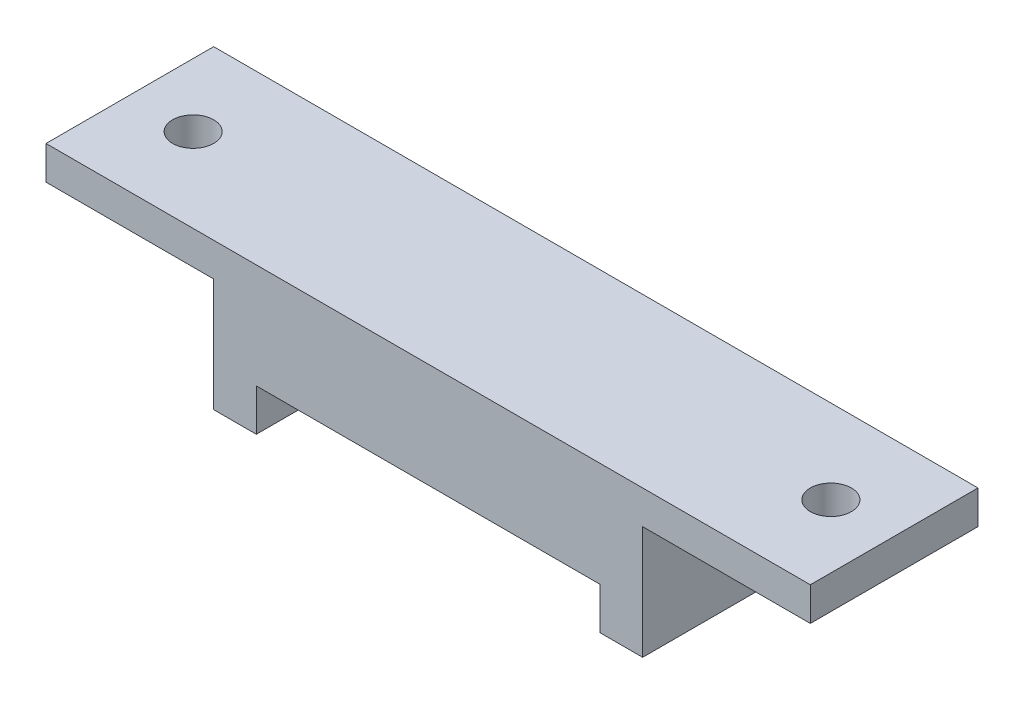
from build123d import *

# Parameters (mm, degrees)
SKETCH1_W                           = 165.58
SKETCH1_H                           = 232.3
BOSS_EXTRUDE1_DEPTH                 = 92.73
SKETCH2_W                           = 75.15
SKETCH2_H                           = 134
CUT_EXTRUDE1_DEPTH                  = 238.509525392
SKETCH3_W                           = 92.73
SKETCH3_H                           = 93.5
BOSS_EXTRUDE2_DEPTH                 = 32.57
CUT_EXTRUDE2_DEPTH                  = 79.2
CUT_EXTRUDE3_DEPTH                  = 36.3
CUT_EXTRUDE4_REACH                  = 229.171
SKETCH6_W                           = 115.5
SKETCH6_H                           = 51.5
CUT_EXTRUDE5_DEPTH                  = 115.5
SKETCH8_W                           = 115.5
SKETCH8_H                           = 10.5
CUT_EXTRUDE6_DEPTH                  = 4.5
CUT_EXTRUDE7_START                  = 13.5
SKETCH9_W                           = 115.5
SKETCH9_H                           = 58
CUT_EXTRUDE7_DEPTH                  = 4.5
CUT_EXTRUDE8_DEPTH                  = 115.5
SKETCH11_W                          = 79.15
SKETCH11_H                          = 65.15
CUT_EXTRUDE9_DEPTH                  = 90.3
SKETCH12_W                          = 16.44
SKETCH12_H                          = 88.3
CUT_EXTRUDE10_DEPTH                 = 236.602365549
SKETCH13_W                          = 58.15
SKETCH13_H                          = 58.15
CUT_EXTRUDE11_DEPTH                 = 5
F_5_0_5_DIAMETER_HOLE1_D            = 5
F_5_0_5_DIAMETER_HOLE1_DEPTH        = 5
SKETCH16_W                          = 2.45
SKETCH16_H                          = 98.3
F_4_9_4_9_DIAMETER_HOLE1_AT_2_COUNT = 2
F_4_9_4_9_DIAMETER_HOLE1_AT_2_PITCH = 66.651885195
F_4_9_4_9_DIAMETER_HOLE1_AT_3_COUNT = 2
F_4_9_4_9_DIAMETER_HOLE1_AT_3_PITCH = 47.13
F_4_9_4_9_DIAMETER_HOLE1_AT_4_COUNT = 2
F_4_9_4_9_DIAMETER_HOLE1_AT_4_PITCH = 47.13
SKETCH18_W                          = 19.55
SKETCH18_H                          = 98.3
M45_CLEARANCE_HOLE1_D               = 49.74
M45_CLEARANCE_HOLE1_DEPTH           = 2.5
FILLET1_R                           = 2.5
FILLET2_R                           = 3.758324095
SKETCH22_W                          = 123
SKETCH22_H                          = 10
BOSS_EXTRUDE3_DEPTH                 = 18
SKETCH23_W                          = 123
SKETCH23_H                          = 10
BOSS_EXTRUDE4_DEPTH                 = 17
FILLET3_R                           = 10
SKETCH26_R                          = 3.95
CUT_EXTRUDE12_DEPTH                 = 17
CUT_EXTRUDE14_DEPTH                 = 92.73
SKETCH28_W                          = 20
SKETCH28_H                          = 30
BOSS_EXTRUDE5_DEPTH                 = 20
SKETCH29_W                          = 20
SKETCH29_H                          = 30
BOSS_EXTRUDE6_DEPTH                 = 20
SKETCH30_W                          = 34
SKETCH30_H                          = 11
CUT_EXTRUDE15_DEPTH                 = 4
SKETCH31_R                          = 2.45
CUT_EXTRUDE16_DEPTH                 = 11
SKETCH32_W                          = 20
SKETCH32_H                          = 30
BOSS_EXTRUDE7_DEPTH                 = 20
SKETCH33_W                          = 20
SKETCH33_H                          = 30
BOSS_EXTRUDE8_DEPTH                 = 20
SKETCH34_R                          = 2.45
CUT_EXTRUDE17_DEPTH                 = 11
SKETCH36_W                          = 11
SKETCH36_H                          = 30
CUT_EXTRUDE19_DEPTH                 = 4
SKETCH37_W                          = 11
SKETCH37_H                          = 30
CUT_EXTRUDE20_DEPTH                 = 4
CUT_EXTRUDE18_START                 = -11
SKETCH35_R                          = 2.45
CUT_EXTRUDE18_DEPTH                 = 11
SKETCH38_W                          = 11
SKETCH38_H                          = 30
CUT_EXTRUDE21_DEPTH                 = 1.4
SKETCH39_R                          = 2.45
CUT_EXTRUDE22_DEPTH                 = 7
SKETCH40_W                          = 34
SKETCH40_H                          = 4.7
BOSS_EXTRUDE10_DEPTH                = 3.3
SKETCH41_R                          = 2.45
CUT_EXTRUDE23_DEPTH                 = 23.3
SKETCH42_W                          = 5
SKETCH42_H                          = 20.5
CUT_EXTRUDE24_DEPTH                 = 1.2
CUT_EXTRUDE25_DEPTH                 = 3
SKETCH45_W                          = 20
SKETCH45_H                          = 20
BOSS_EXTRUDE13_DEPTH                = 4.7
SKETCH46_W                          = 20
SKETCH46_H                          = 20
BOSS_EXTRUDE14_DEPTH                = 24
SKETCH47_W                          = 5
SKETCH47_H                          = 20
CUT_EXTRUDE26_DEPTH                 = 1.2
SKETCH48_R                          = 2.45
CUT_EXTRUDE27_DEPTH                 = 31.2
CUT_EXTRUDE28_DEPTH                 = 3
SKETCH50_W                          = 20
SKETCH50_H                          = 20
CUT_EXTRUDE29_DEPTH                 = 3
SKETCH52_W                          = 30
SKETCH52_H                          = 30
BOSS_EXTRUDE15_DEPTH                = 50
BOSS_EXTRUDE16_DEPTH                = 30
CUT_EXTRUDE30_DEPTH                 = 50
SKETCH55_W                          = 30
SKETCH55_H                          = 9
BOSS_EXTRUDE17_DEPTH                = 18
SKETCH56_W                          = 5
SKETCH56_H                          = 18
CUT_EXTRUDE31_DEPTH                 = 1.5
SKETCH57_R                          = 2.45
CUT_EXTRUDE32_DEPTH                 = 11.5
CUT_EXTRUDE33_DEPTH                 = 3
SKETCH59_W                          = 9
SKETCH59_H                          = 30
BOSS_EXTRUDE18_DEPTH                = 18
SKETCH62_W                          = 22.8
SKETCH62_H                          = 5
CUT_EXTRUDE35_DEPTH                 = 1.5
SKETCH63_R                          = 2.45
CUT_EXTRUDE36_DEPTH                 = 12
CUT_EXTRUDE37_DEPTH                 = 3
SKETCH67_W                          = 21
SKETCH67_H                          = 5
CUT_EXTRUDE40_DEPTH                 = 45
SKETCH69_R                          = 5
CUT_EXTRUDE42_DEPTH                 = 30
SKETCH71_W                          = 4.5
SKETCH71_H                          = 4
CUT_EXTRUDE43_DEPTH                 = 115.5
BOSS_EXTRUDE19_DEPTH                = 115.5
SKETCH73_W                          = 32
SKETCH73_H                          = 0.465
CUT_EXTRUDE44_DEPTH                 = 115.5
BOSS_EXTRUDE21_START                = -5
SKETCH74_R                          = 2.5
BOSS_EXTRUDE21_DEPTH                = 5
SKETCH75_R                          = 2.45
CUT_EXTRUDE45_DEPTH                 = 5
SKETCH79_W                          = 65.082601473
SKETCH79_H                          = 90.740818932
CUT_EXTRUDE46_DEPTH                 = 20
SKETCH80_W                          = 34
SKETCH80_H                          = 11
BOSS_EXTRUDE22_DEPTH                = 11
SKETCH81_W                          = 63.959797262
SKETCH81_H                          = 80.4
CUT_EXTRUDE47_DEPTH                 = 20
SKETCH82_W                          = 40
SKETCH82_H                          = 20
CUT_EXTRUDE48_DEPTH                 = 21
SKETCH83_W                          = 40
SKETCH83_H                          = 20
CUT_EXTRUDE49_DEPTH                 = 21
SKETCH84_W                          = 21.566024368
SKETCH84_H                          = 21.353891393
BOSS_EXTRUDE23_DEPTH                = 92.73
SKETCH85_W                          = 90.43
SKETCH85_H                          = 30.5
CUT_EXTRUDE50_DEPTH                 = 9
SKETCH86_W                          = 90.43
SKETCH86_H                          = 30.5
CUT_EXTRUDE51_DEPTH                 = 9
SKETCH87_W                          = 34.73
SKETCH87_H                          = 30.5
CUT_EXTRUDE52_DEPTH                 = 90.43
SKETCH88_W                          = 18
SKETCH88_H                          = 12.59228479
SKETCH88_H_2                        = 17.40771521
SKETCH88_W_2                        = 5
SKETCH88_H_3                        = 18
SKETCH88_W_3                        = 12.5
CUT_EXTRUDE53_DEPTH                 = 9
BOSS_EXTRUDE24_DEPTH                = 30
SKETCH90_W                          = 4.8
SKETCH90_H                          = 5
BOSS_EXTRUDE25_DEPTH                = 1.5
SKETCH91_W                          = 5.95
SKETCH91_H                          = 20.4
BOSS_EXTRUDE26_DEPTH                = 50
BOSS_EXTRUDE27_REACH                = 298.893
SKETCH94_W                          = 18.5
SKETCH94_H                          = 5.65771521
SKETCH94_H_2                        = 30
SKETCH94_W_2                        = 8.5
SKETCH94_H_3                        = 20.4
SKETCH94_H_4                        = 5.84228479
CUT_EXTRUDE54_START                 = -50
CUT_EXTRUDE54_OUTLINE_W             = 5.75
CUT_EXTRUDE54_OUTLINE_H             = 33.96543042
CUT_EXTRUDE54_OUTLINE_H_2           = 30
CUT_EXTRUDE54_DEPTH                 = 50
SKETCH96_W                          = 6.443449297
SKETCH96_H                          = 0.829453856
SKETCH96_W_2                        = 5.985
SKETCH96_H_2                        = 0.414726928
CUT_EXTRUDE55_DEPTH                 = 50
SKETCH98_W                          = 90.43
SKETCH98_H                          = 30.5
BOSS_EXTRUDE28_DEPTH                = 13
SKETCH99_W                          = 90.43
SKETCH99_H                          = 10
BOSS_EXTRUDE29_DEPTH                = 13
SKETCH100_W                         = 32.57
SKETCH100_H                         = 10
BOSS_EXTRUDE30_DEPTH                = 13
SKETCH102_W                         = 50.73
SKETCH102_H                         = 30.5
CUT_EXTRUDE56_DEPTH                 = 99
SKETCH103_W                         = 8.4
SKETCH103_H                         = 30.4
CUT_EXTRUDE57_DEPTH                 = 50
SKETCH104_W                         = 0.05
SKETCH104_H                         = 20.4
BOSS_EXTRUDE31_DEPTH                = 50
SKETCH105_W                         = 9
SKETCH105_H                         = 0.05
BOSS_EXTRUDE32_DEPTH                = 90.43
SKETCH106_W                         = 9
SKETCH106_H                         = 0.05
BOSS_EXTRUDE33_DEPTH                = 32.57
SKETCH109_W                         = 18.5
SKETCH109_H                         = 41.5
SKETCH109_W_2                       = 8.4
SKETCH109_H_2                       = 30.4
BOSS_EXTRUDE34_DEPTH                = 20
SKETCH110_W                         = 50.73
SKETCH110_H                         = 30.5
BOSS_EXTRUDE35_DEPTH                = 5
SKETCH113_W                         = 172.054725646
SKETCH113_H                         = 266.387097994
CUT_EXTRUDE58_DEPTH                 = 138.8
SKETCH114_W                         = 178.406474635
SKETCH114_H                         = 123.917797654
CUT_EXTRUDE59_DEPTH                 = 18
SKETCH115_W                         = 177.074465968
SKETCH115_H                         = 136.072490388
CUT_EXTRUDE60_DEPTH                 = 17
SKETCH116_W                         = 133.782615836
SKETCH116_H                         = 155.721244156
CUT_EXTRUDE61_DEPTH                 = 108
SKETCH117_W                         = 5.565
SKETCH117_H                         = 88.035
SKETCH117_W_2                       = 15.9965
CUT_EXTRUDE62_DEPTH                 = 20
SKETCH118_W                         = 71.1685
SKETCH118_H                         = 5
CUT_EXTRUDE63_DEPTH                 = 20
BOSS_EXTRUDE36_START                = 5
SKETCH119_R                         = 2.45
BOSS_EXTRUDE36_DEPTH                = 5
SKETCH120_W                         = 20
SKETCH120_H                         = 5
BOSS_EXTRUDE37_DEPTH                = 14.432517826
SKETCH121_W                         = 71.1685
SKETCH121_H                         = 20
BOSS_EXTRUDE38_DEPTH                = 7.5
SKETCH126_W                         = 20
SKETCH126_H                         = 14
CUT_EXTRUDE65_DEPTH                 = 10
SKETCH123_W                         = 20
SKETCH123_H                         = 5
BOSS_EXTRUDE41_DEPTH                = 10
SKETCH128_R                         = 2.45
CUT_EXTRUDE66_DEPTH                 = 10
SKETCH124_W                         = 20
SKETCH124_H                         = 5
BOSS_EXTRUDE42_DEPTH                = 10
SKETCH129_R                         = 2.45
CUT_EXTRUDE67_DEPTH                 = 10
SKETCH130_W                         = 71.1685
SKETCH130_H                         = 71.535
CUT_EXTRUDE68_DEPTH                 = 20
CUT_EXTRUDE69_DEPTH                 = 20
SKETCH132_W                         = 5.344
SKETCH132_H                         = 20
SKETCH132_W_2                       = 5.441
CUT_EXTRUDE70_DEPTH                 = 1.5
SKETCH133_W                         = 40.995
SKETCH133_H                         = 5
CUT_EXTRUDE71_DEPTH                 = 20
SKETCH134_W                         = 0.05
SKETCH134_H                         = 5
CUT_EXTRUDE72_DEPTH                 = 20
SKETCH135_W                         = 0.05
SKETCH135_H                         = 5
BOSS_EXTRUDE43_DEPTH                = 20
SKETCH138_W                         = 19.9985
SKETCH138_H                         = 20
SKETCH138_W_2                       = 20
CUT_EXTRUDE73_DEPTH                 = 1


# Read off the part's stored shape, not the designer's step: Cut-Extrude54
with BuildPart() as part:
    # Sketch1 → Boss-Extrude1 (new body)
    with BuildSketch(Plane(origin=(45.486013603, 0, 0), x_dir=(0, 0, -1), z_dir=(1, 0, 0))):
        with Locations((-19.180804236, 77.276670435)):
            Rectangle(SKETCH1_W, SKETCH1_H)
    extrude(amount=-BOSS_EXTRUDE1_DEPTH)

    # Sketch2 → Cut-Extrude1 (cut, through all)
    with BuildSketch(Plane.ZY.offset(47.243986397)):
        with Locations((64.395804236, 28.126670435)):
            Rectangle(SKETCH2_W, SKETCH2_H)
    extrude(amount=-CUT_EXTRUDE1_DEPTH, mode=Mode.SUBTRACT)

    # Sketch3 → Boss-Extrude2 (add)
    with BuildSketch(Plane.XY.offset(26.820804236)):
        with Locations((-0.878986397, 7.876670435)):
            Rectangle(SKETCH3_W, SKETCH3_H)
    extrude(amount=BOSS_EXTRUDE2_DEPTH)

    # Sketch4 → Cut-Extrude2 (cut)
    with BuildSketch(Plane.XY.offset(59.390804236)):
        with BuildLine():
            Line((1.078889782, -38.873329565), (1.078889782, -28.873329565))
            ThreePointArc((1.078889782, -28.873329565), (1.700753014, -28.742266644), (2.047801243, -28.209867454))
            Line((2.047801243, -28.209867454), (5.383137423, -22.873329565))
            Line((5.383137423, -22.873329565), (9.856013603, -22.873329565))
            Line((9.856013603, -22.873329565), (9.856013603, 44.626670435))
            Line((9.856013603, 44.626670435), (-22.143986397, 44.626670435))
            Line((-22.143986397, 44.626670435), (-22.143986397, -22.873329565))
            Line((-22.143986397, -22.873329565), (-17.671110218, -22.873329565))
            Line((-17.671110218, -22.873329565), (-14.305353901, -28.258539673))
            ThreePointArc((-14.305353901, -28.258539673), (-13.956818128, -28.763043498), (-13.353628044, -28.873329565))
            Line((-13.353628044, -28.873329565), (-13.353628044, -38.873329565))
            Line((-13.353628044, -38.873329565), (1.078889782, -38.873329565))
        make_face()
    extrude(amount=-CUT_EXTRUDE2_DEPTH, mode=Mode.SUBTRACT)

    # Sketch5 → Cut-Extrude3 (cut)
    with BuildSketch(Plane.XY.offset(-19.809195764)):
        with BuildLine():
            Line((9.856013603, -22.873329565), (9.856013603, 44.626670435))
            Line((9.856013603, 44.626670435), (-22.143986397, 44.626670435))
            Line((-22.143986397, 44.626670435), (-22.143986397, -22.873329565))
            Line((-22.143986397, -22.873329565), (-17.671110218, -22.873329565))
            Line((-17.671110218, -22.873329565), (-14.305353901, -28.258539673))
            ThreePointArc((-14.305353901, -28.258539673), (-13.956818128, -28.763043498), (-13.353628044, -28.873329565))
            Line((-13.353628044, -28.873329565), (1.078889782, -28.873329565))
            ThreePointArc((1.078889782, -28.873329565), (1.700753014, -28.742266644), (2.047801243, -28.209867454))
            Line((2.047801243, -28.209867454), (5.383137423, -22.873329565))
            Line((5.383137423, -22.873329565), (9.856013603, -22.873329565))
        make_face()
    extrude(amount=-CUT_EXTRUDE3_DEPTH, mode=Mode.SUBTRACT)

    # Sketch6 → Cut-Extrude4 (cut, up to next)
    with BuildSketch(Plane(origin=(14.356013603, 0, 0), x_dir=(0, 0, -1), z_dir=(1, 0, 0)), mode=Mode.PRIVATE) as cut_extrude4_sk1:
        with Locations((-1.640804236, 18.876670435)):
            Rectangle(SKETCH6_W, SKETCH6_H)
    cut_extrude4_tool1 = extrude(cut_extrude4_sk1.sketch, amount=-CUT_EXTRUDE4_REACH, mode=Mode.PRIVATE) & part.part
    add(cut_extrude4_tool1.solids().sort_by_distance((14.356014, 18.87667, 1.640804))[0], mode=Mode.SUBTRACT)

    # Sketch7 → Cut-Extrude5 (cut)
    with BuildSketch(Plane.XY.offset(59.390804236)):
        with BuildLine():
            Line((14.356013603, 36.626670435), (14.356013603, -6.873329565))
            Line((14.356013603, -6.873329565), (20.856013603, -6.873329565))
            ThreePointArc((20.856013603, -6.873329565), (23.527333946, -6.222467368), (24.956013603, -3.873329565))
            Line((24.956013603, -3.873329565), (24.956013603, 34.126670435))
            Line((24.956013603, 34.126670435), (18.356013603, 34.126670435))
            ThreePointArc((18.356013603, 34.126670435), (15.83824665, 34.54824331), (14.356013603, 36.626670435))
        make_face()
    extrude(amount=-CUT_EXTRUDE5_DEPTH, mode=Mode.SUBTRACT)

    # Sketch8 → Cut-Extrude6 (cut)
    with BuildSketch(Plane.ZY.offset(-9.856013603)):
        with Locations((1.640804236, -12.123329565)):
            Rectangle(SKETCH8_W, SKETCH8_H)
    extrude(amount=-CUT_EXTRUDE6_DEPTH, mode=Mode.SUBTRACT)

    # Sketch9 → Cut-Extrude7 (cut)
    with BuildSketch(Plane(origin=(-35.643986397, 0, 0), x_dir=(0, 0, -1), z_dir=(1, 0, 0)).offset(CUT_EXTRUDE7_START)):
        with Locations((-1.640804236, 15.626670435)):
            Rectangle(SKETCH9_W, SKETCH9_H)
    extrude(amount=-CUT_EXTRUDE7_DEPTH, mode=Mode.SUBTRACT)

    # Sketch10 → Cut-Extrude8 (cut)
    with BuildSketch(Plane.XY.offset(59.390804236)):
        with BuildLine():
            Line((-26.643986397, -9.373329565), (-26.643986397, 34.126670435))
            Line((-26.643986397, 34.126670435), (-37.143986397, 34.126670435))
            Line((-37.143986397, 34.126670435), (-37.143986397, -6.873329565))
            Line((-37.143986397, -6.873329565), (-30.643986397, -6.873329565))
            ThreePointArc((-30.643986397, -6.873329565), (-28.126219444, -7.294902441), (-26.643986397, -9.373329565))
        make_face()
    extrude(amount=-CUT_EXTRUDE8_DEPTH, mode=Mode.SUBTRACT)

    # Sketch11 → Cut-Extrude9 (cut)
    with BuildSketch(Plane(origin=(0, 193.426670435, 0), x_dir=(-1, 0, 0), z_dir=(0, 1, 0))):
        with Locations((-0.911013603, 64.395804236)):
            Rectangle(SKETCH11_W, SKETCH11_H)
    extrude(amount=-CUT_EXTRUDE9_DEPTH, mode=Mode.SUBTRACT)

    # Sketch12 → Cut-Extrude10 (cut, through all)
    with BuildSketch(Plane.ZY.offset(-40.486013603)):
        with Locations((63.849186595, 149.276670435)):
            Rectangle(SKETCH12_W, SKETCH12_H)
    extrude(amount=-CUT_EXTRUDE10_DEPTH, mode=Mode.SUBTRACT)

    # Sketch13 → Cut-Extrude11 (cut)
    with BuildSketch(Plane(origin=(0, 103.126670435, 0), x_dir=(-1, 0, 0), z_dir=(0, 1, 0))):
        with Locations((6.088986397, 64.395804236)):
            Rectangle(SKETCH13_W, SKETCH13_H)
    extrude(amount=-CUT_EXTRUDE11_DEPTH, mode=Mode.SUBTRACT)

    # Ø5.0 (5) Diameter Hole1
    with Locations(Plane.XY.offset(59.390804236)):
        with Locations((18.856013603, -11.373329565), (-31.143986397, 38.626670435), (18.856013603, 38.626670435), (-31.143986397, -11.373329565)):
            Hole(F_5_0_5_DIAMETER_HOLE1_D / 2, depth=F_5_0_5_DIAMETER_HOLE1_DEPTH)

    # Sketch16 → Ø4.9 (4.9) Diameter Hole1 (revolve, cut)
    with BuildSketch(Plane(origin=(-29.653986397, 95.126670435, 87.960804236), x_dir=(0, 0, -1), z_dir=(1, 0, 0))):
        with Locations((1.225, 49.15)):
            Rectangle(SKETCH16_W, SKETCH16_H)
    f_4_9_4_9_diameter_hole1 = revolve(axis=Axis((-29.653986397, 88.776670435, 87.960804236), (0, 1, 0)), mode=Mode.SUBTRACT)

    # Ø4.9 (4.9) Diameter Hole1 at 2: Ø4.9 (4.9) Diameter Hole1 ×2
    with Locations(*[Vector(0.7071067811865476, 0, -0.7071067811865476) * (i * F_4_9_4_9_DIAMETER_HOLE1_AT_2_PITCH) for i in range(1, F_4_9_4_9_DIAMETER_HOLE1_AT_2_COUNT)]):
        add(f_4_9_4_9_diameter_hole1, mode=Mode.SUBTRACT)

    # Ø4.9 (4.9) Diameter Hole1 at 3: Ø4.9 (4.9) Diameter Hole1 ×2
    with Locations(*[(i * F_4_9_4_9_DIAMETER_HOLE1_AT_3_PITCH, 0, 0) for i in range(1, F_4_9_4_9_DIAMETER_HOLE1_AT_3_COUNT)]):
        add(f_4_9_4_9_diameter_hole1, mode=Mode.SUBTRACT)

    # Ø4.9 (4.9) Diameter Hole1 at 4: Ø4.9 (4.9) Diameter Hole1 ×2
    with Locations(*[(0, 0, -i * F_4_9_4_9_DIAMETER_HOLE1_AT_4_PITCH) for i in range(1, F_4_9_4_9_DIAMETER_HOLE1_AT_4_COUNT)]):
        add(f_4_9_4_9_diameter_hole1, mode=Mode.SUBTRACT)

    # Sketch18 → M36 Clearance Hole1 (revolve, cut)
    with BuildSketch(Plane(origin=(-6.088986397, 95.126670435, 64.395804236), x_dir=(0, 0, -1), z_dir=(1, 0, 0))):
        with Locations((9.775, 49.15)):
            Rectangle(SKETCH18_W, SKETCH18_H)
    revolve(axis=Axis((-6.088986397, 88.776670435, 64.395804236), (0, 1, 0)), mode=Mode.SUBTRACT)

    # M45 Clearance Hole1
    with Locations(Plane.XY.offset(-56.109195764)):
        with Locations((-6.143986397, 13.626670435)):
            Hole(M45_CLEARANCE_HOLE1_D / 2, depth=M45_CLEARANCE_HOLE1_DEPTH)

    # Fillet1
    fillet1_edges = [part.edges().sort_by_distance(p)[0] for p in [
        (14.356013603, -6.873329565, 1.640804236),
        (-26.643986397, 34.126670435, 1.640804236),
        (22.986013603, 100.626670435, 35.320804236),
        (22.986013603, 100.626670435, 93.470804236),
        (-35.163986397, 100.626670435, 93.470804236),
        (-35.163986397, 100.626670435, 35.320804236),
    ]]
    fillet(fillet1_edges, radius=FILLET1_R)

    # Fillet2
    fillet2_edges = [part.edges().sort_by_distance(p)[0] for p in [
        (14.356013603, 44.626670435, 1.640804236),
        (-37.143986397, 34.126670435, 1.640804236),
    ]]
    fillet(fillet2_edges, radius=FILLET2_R)

    # Sketch22 → Boss-Extrude3 (add)
    with BuildSketch(Plane.ZY.offset(47.243986397)):
        with Locations((-2.109195764, -33.873329565)):
            Rectangle(SKETCH22_W, SKETCH22_H)
    extrude(amount=BOSS_EXTRUDE3_DEPTH)

    # Sketch23 → Boss-Extrude4 (add)
    with BuildSketch(Plane(origin=(45.486013603, 0, 0), x_dir=(0, 0, -1), z_dir=(1, 0, 0))):
        with Locations((2.109195764, -33.873329565)):
            Rectangle(SKETCH23_W, SKETCH23_H)
    extrude(amount=BOSS_EXTRUDE4_DEPTH)

    # Fillet3
    fillet3_edges = [part.edges().sort_by_distance(p)[0] for p in [
        (62.486013603, -33.873329565, -63.609195764),
    ]]
    fillet(fillet3_edges, radius=FILLET3_R)

    # Sketch26 → Cut-Extrude12 (cut)
    with BuildSketch(Plane.XZ.offset(38.873329565)):
        with Locations(Location((53.036013603, -54.159195764, 0), (0, 0, 270))):
            Circle(SKETCH26_R)
        with Locations(Location((-56.243986397, -2.109195764, 0), (0, 0, 270))):
            Circle(SKETCH26_R)
        with Locations(Location((-56.243986397, 51.940804236, 0), (0, 0, 270))):
            Circle(SKETCH26_R)
        with Locations(Location((53.986013603, 51.940804236, 0), (0, 0, 270))):
            Circle(SKETCH26_R)
        with Locations(Location((53.986013603, -2.109195764, 0), (0, 0, 270))):
            Circle(SKETCH26_R)
        with Locations(Location((-57.793986397, -56.159195764, 0), (0, 0, 270))):
            Circle(SKETCH26_R)
    extrude(amount=-CUT_EXTRUDE12_DEPTH, mode=Mode.SUBTRACT)

    # Sketch27 → Cut-Extrude14 (cut)
    with BuildSketch(Plane.ZY.offset(47.243986397)):
        with BuildLine():
            Line((-53.609195764, 55.136670435), (-53.609195764, 74.516670435))
            ThreePointArc((-53.609195764, 74.516670435), (-53.459820222, 74.877294893), (-53.099195764, 75.026670435))
            Line((-53.099195764, 75.026670435), (-33.719195764, 75.026670435))
            ThreePointArc((-33.719195764, 75.026670435), (-33.358571305, 74.877294893), (-33.209195764, 74.516670435))
            Line((-33.209195764, 74.516670435), (-33.209195764, 55.136670435))
            ThreePointArc((-33.209195764, 55.136670435), (-33.358571305, 54.776045976), (-33.719195764, 54.626670435))
            Line((-33.719195764, 54.626670435), (-53.099195764, 54.626670435))
            ThreePointArc((-53.099195764, 54.626670435), (-53.459820222, 54.776045976), (-53.609195764, 55.136670435))
        make_face()
    extrude(amount=-CUT_EXTRUDE14_DEPTH, mode=Mode.SUBTRACT)

    # Sketch28 → Boss-Extrude5 (add)
    with BuildSketch(Plane.ZY.offset(47.243986397)):
        with Locations((-43.409195764, 39.626670435)):
            Rectangle(SKETCH28_W, SKETCH28_H)
    extrude(amount=BOSS_EXTRUDE5_DEPTH)

    # Sketch29 → Boss-Extrude6 (add)
    with BuildSketch(Plane(origin=(45.486013603, 0, 0), x_dir=(0, 0, -1), z_dir=(1, 0, 0))):
        with Locations((43.409195764, 39.626670435)):
            Rectangle(SKETCH29_W, SKETCH29_H)
    extrude(amount=BOSS_EXTRUDE6_DEPTH)

    # Sketch30 → Cut-Extrude15 (cut)
    with BuildSketch(Plane.ZY.offset(47.243986397)):
        with Locations((-16.209195764, 64.826670435)):
            Rectangle(SKETCH30_W, SKETCH30_H)
    extrude(amount=-CUT_EXTRUDE15_DEPTH, mode=Mode.SUBTRACT)

    # Sketch31 → Cut-Extrude16 (cut)
    with BuildSketch(Plane.ZY.offset(47.243986397)):
        with Locations((-28.249195764, 64.826670435)):
            Circle(SKETCH31_R)
        with Locations((-8.249195764, 64.826670435)):
            Circle(SKETCH31_R)
    extrude(amount=-CUT_EXTRUDE16_DEPTH, mode=Mode.SUBTRACT)

    # Sketch32 → Boss-Extrude7 (add)
    with BuildSketch(Plane.ZY.offset(47.243986397)):
        with Locations((-43.409195764, 90.026670435)):
            Rectangle(SKETCH32_W, SKETCH32_H)
    extrude(amount=BOSS_EXTRUDE7_DEPTH)

    # Sketch33 → Boss-Extrude8 (add)
    with BuildSketch(Plane(origin=(45.486013603, 0, 0), x_dir=(0, 0, -1), z_dir=(1, 0, 0))):
        with Locations((43.409195764, 90.026670435)):
            Rectangle(SKETCH33_W, SKETCH33_H)
    extrude(amount=BOSS_EXTRUDE8_DEPTH)

    # Sketch34 → Cut-Extrude17 (cut)
    with BuildSketch(Plane.ZY.offset(67.243986397)):
        with Locations((-43.409195764, 79.986670435)):
            Circle(SKETCH34_R)
        with Locations((-43.409195764, 99.986670435)):
            Circle(SKETCH34_R)
    extrude(amount=-CUT_EXTRUDE17_DEPTH, mode=Mode.SUBTRACT)

    # Sketch36 → Cut-Extrude19 (cut)
    with BuildSketch(Plane.ZY.offset(67.243986397)):
        with Locations((-43.409195764, 90.026670435)):
            Rectangle(SKETCH36_W, SKETCH36_H)
    extrude(amount=-CUT_EXTRUDE19_DEPTH, mode=Mode.SUBTRACT)

    # Sketch37 → Cut-Extrude20 (cut)
    with BuildSketch(Plane(origin=(65.486013603, 0, 0), x_dir=(0, 0, -1), z_dir=(1, 0, 0))):
        with Locations((43.409195764, 90.026670435)):
            Rectangle(SKETCH37_W, SKETCH37_H)
    extrude(amount=-CUT_EXTRUDE20_DEPTH, mode=Mode.SUBTRACT)

    # Sketch35 → Cut-Extrude18 (cut)
    with BuildSketch(Plane(origin=(65.486013603, 0, 0), x_dir=(0, 0, -1), z_dir=(1, 0, 0)).offset(CUT_EXTRUDE18_START)):
        with Locations(Location((43.409195764, 79.986670435, 0), (0, 0, 180))):
            Circle(SKETCH35_R)
        with Locations(Location((43.409195764, 99.986670435, 0), (0, 0, 180))):
            Circle(SKETCH35_R)
    extrude(amount=CUT_EXTRUDE18_DEPTH, mode=Mode.SUBTRACT)

    # Sketch38 → Cut-Extrude21 (cut)
    with BuildSketch(Plane.ZY.offset(67.243986397)):
        with Locations((-43.409195764, 39.626670435)):
            Rectangle(SKETCH38_W, SKETCH38_H)
    cut_extrude21 = extrude(amount=-CUT_EXTRUDE21_DEPTH, mode=Mode.SUBTRACT)

    # Sketch39 → Cut-Extrude22 (cut)
    with BuildSketch(Plane.ZY.offset(65.843986397)):
        with Locations((-43.409195764, 49.866670435)):
            Circle(SKETCH39_R)
        with Locations((-43.409195764, 29.866670435)):
            Circle(SKETCH39_R)
    cut_extrude22 = extrude(amount=-CUT_EXTRUDE22_DEPTH, mode=Mode.SUBTRACT)

    # Sketch40 → Boss-Extrude10 (add)
    with BuildSketch(Plane.ZY.offset(47.243986397)):
        with Locations((-16.209195764, 72.676670435)):
            Rectangle(SKETCH40_W, SKETCH40_H)
        with Locations((-16.209195764, 56.976670435)):
            Rectangle(SKETCH40_W, SKETCH40_H)
    boss_extrude10 = extrude(amount=BOSS_EXTRUDE10_DEPTH)

    # Sketch41 → Cut-Extrude23 (cut)
    with BuildSketch(Plane.XY.offset(-33.409195764)):
        with Locations((-60.643986397, 86.276670435)):
            Circle(SKETCH41_R)
    cut_extrude23 = extrude(amount=-CUT_EXTRUDE23_DEPTH, mode=Mode.SUBTRACT)

    # Sketch42 → Cut-Extrude24 (cut)
    with BuildSketch(Plane.XY.offset(-33.409195764)):
        with Locations((-60.643986397, 85.276670435)):
            Rectangle(SKETCH42_W, SKETCH42_H)
    cut_extrude24 = extrude(amount=-CUT_EXTRUDE24_DEPTH, mode=Mode.SUBTRACT)

    # Sketch43 → Cut-Extrude25 (cut)
    with BuildSketch(Plane(origin=(0, 0, -53.409195764), x_dir=(-1, 0, 0), z_dir=(0, 0, -1))):
        Polygon((65.551463685, 86.276670435), (63.097725041, 90.526670435), (58.190247753, 90.526670435), (55.736509109, 86.276670435), (58.190247753, 82.026670435), (63.097725041, 82.026670435), align=None)
    cut_extrude25 = extrude(amount=-CUT_EXTRUDE25_DEPTH, mode=Mode.SUBTRACT)

    # Sketch45 → Boss-Extrude13 (add)
    with BuildSketch(Plane.ZY.offset(47.243986397)):
        with Locations((49.390804236, 44.626670435)):
            Rectangle(SKETCH45_W, SKETCH45_H)
    boss_extrude13 = extrude(amount=BOSS_EXTRUDE13_DEPTH)

    # Sketch46 → Boss-Extrude14 (add)
    with BuildSketch(Plane.ZY.offset(47.243986397)):
        with Locations((29.390804236, 44.626670435)):
            Rectangle(SKETCH46_W, SKETCH46_H)
    boss_extrude14 = extrude(amount=BOSS_EXTRUDE14_DEPTH)

    # Sketch47 → Cut-Extrude26 (cut)
    with BuildSketch(Plane.XY.offset(39.390804236)):
        with Locations((-60.643986397, 44.626670435)):
            Rectangle(SKETCH47_W, SKETCH47_H)
    cut_extrude26 = extrude(amount=-CUT_EXTRUDE26_DEPTH, mode=Mode.SUBTRACT)

    # Sketch48 → Cut-Extrude27 (cut)
    with BuildSketch(Plane.XY.offset(38.190804236)):
        with Locations((-60.643986397, 43.926670435)):
            Circle(SKETCH48_R)
    cut_extrude27 = extrude(amount=-CUT_EXTRUDE27_DEPTH, mode=Mode.SUBTRACT)

    # Sketch49 → Cut-Extrude28 (cut)
    with BuildSketch(Plane(origin=(0, 0, 19.390804236), x_dir=(-1, 0, 0), z_dir=(0, 0, -1))):
        Polygon((64.893986397, 41.472931791), (64.893986397, 46.380409079), (60.643986397, 48.834147723), (56.393986397, 46.380409079), (56.393986397, 41.472931791), (60.643986397, 39.019193147), align=None)
    cut_extrude28 = extrude(amount=-CUT_EXTRUDE28_DEPTH, mode=Mode.SUBTRACT)

    # Sketch50 → Cut-Extrude29 (cut)
    with BuildSketch(Plane.ZY.offset(71.243986397)):
        with Locations((29.390804236, 44.626670435)):
            Rectangle(SKETCH50_W, SKETCH50_H)
    cut_extrude29 = extrude(amount=-CUT_EXTRUDE29_DEPTH, mode=Mode.SUBTRACT)

    # Mirror1: Boss-Extrude10 across plane
    add(boss_extrude10.mirror(Plane.ZY.offset(0.878986397)))

    # Mirror2: Cut-Extrude21, Cut-Extrude22 across plane
    add(cut_extrude21.mirror(Plane.ZY.offset(0.878986397)), mode=Mode.SUBTRACT)
    add(cut_extrude22.mirror(Plane.ZY.offset(0.878986397)), mode=Mode.SUBTRACT)

    # Mirror3: Cut-Extrude23, Cut-Extrude24, Cut-Extrude25 across plane
    add(cut_extrude23.mirror(Plane.ZY.offset(0.878986397)), mode=Mode.SUBTRACT)
    add(cut_extrude24.mirror(Plane.ZY.offset(0.878986397)), mode=Mode.SUBTRACT)
    add(cut_extrude25.mirror(Plane.ZY.offset(0.878986397)), mode=Mode.SUBTRACT)

    # Mirror4: Boss-Extrude13, Boss-Extrude14, Cut-Extrude29 across plane
    add(boss_extrude13.mirror(Plane.ZY.offset(0.878986397)))
    add(boss_extrude14.mirror(Plane.ZY.offset(0.878986397)))
    add(cut_extrude29.mirror(Plane.ZY.offset(0.878986397)), mode=Mode.SUBTRACT)

    # Mirror5: Cut-Extrude26, Cut-Extrude27, Cut-Extrude28 across plane
    add(cut_extrude26.mirror(Plane.ZY.offset(0.878986397)), mode=Mode.SUBTRACT)
    add(cut_extrude27.mirror(Plane.ZY.offset(0.878986397)), mode=Mode.SUBTRACT)
    add(cut_extrude28.mirror(Plane.ZY.offset(0.878986397)), mode=Mode.SUBTRACT)

    # Sketch52 → Boss-Extrude15 (add)
    with BuildSketch(Plane.XY.offset(101.970804236)):
        with Locations((-0.878986397, 144.276670435)):
            Rectangle(SKETCH52_W, SKETCH52_H)
    extrude(amount=BOSS_EXTRUDE15_DEPTH)

    # Sketch53 → Boss-Extrude16 (add)
    with BuildSketch(Plane.ZY.offset(15.878986397)):
        Polygon((101.970804236, 95.126670435), (151.970804236, 129.276670435), (101.970804236, 129.276670435), align=None)
    extrude(amount=-BOSS_EXTRUDE16_DEPTH)

    # Sketch54 → Cut-Extrude30 (cut)
    with BuildSketch(Plane.XY.offset(151.970804236)):
        with BuildLine():
            Line((-10.704006919, 133.984385645), (8.892230417, 133.984385645))
            ThreePointArc((8.892230417, 133.984385645), (9.172676703, 134.121105499), (9.321013603, 134.395584282))
            Line((9.321013603, 134.395584282), (9.321013603, 153.973187007))
            ThreePointArc((9.321013603, 153.973187007), (9.172676703, 154.24766579), (8.892230417, 154.384385645))
            Line((8.892230417, 154.384385645), (-10.704006919, 154.384385645))
            ThreePointArc((-10.704006919, 154.384385645), (-10.933186085, 154.271678253), (-11.078986397, 154.061992023))
            Line((-11.078986397, 154.061992023), (-11.078986397, 134.306779267))
            ThreePointArc((-11.078986397, 134.306779267), (-10.933186085, 134.097093036), (-10.704006919, 133.984385645))
        make_face()
    extrude(amount=-CUT_EXTRUDE30_DEPTH, mode=Mode.SUBTRACT)

    # Sketch55 → Boss-Extrude17 (add)
    with BuildSketch(Plane(origin=(0, 159.276670435, 0), x_dir=(1, 0, 0), z_dir=(0, 1, 0))):
        with Locations((-0.878986397, -147.470804236)):
            Rectangle(SKETCH55_W, SKETCH55_H)
    extrude(amount=BOSS_EXTRUDE17_DEPTH)

    # Sketch56 → Cut-Extrude31 (cut)
    with BuildSketch(Plane.XY.offset(151.970804236)):
        with Locations((-0.878986397, 168.276670435)):
            Rectangle(SKETCH56_W, SKETCH56_H)
    extrude(amount=-CUT_EXTRUDE31_DEPTH, mode=Mode.SUBTRACT)

    # Sketch57 → Cut-Extrude32 (cut)
    with BuildSketch(Plane.XY.offset(150.470804236)):
        with Locations((-0.878986397, 165.636670435)):
            Circle(SKETCH57_R)
    extrude(amount=-CUT_EXTRUDE32_DEPTH, mode=Mode.SUBTRACT)

    # Sketch58 → Cut-Extrude33 (cut)
    with BuildSketch(Plane(origin=(0, 0, 142.970804236), x_dir=(-1, 0, 0), z_dir=(0, 0, -1))):
        Polygon((5.031814055, 168.25150423), (0.690887733, 170.540541582), (-3.461939925, 167.925707786), (-3.273841261, 163.021836639), (1.067085062, 160.732799288), (5.21991272, 163.347633083), align=None)
    extrude(amount=-CUT_EXTRUDE33_DEPTH, mode=Mode.SUBTRACT)

    # Sketch59 → Boss-Extrude18 (add)
    with BuildSketch(Plane.ZY.offset(15.878986397)):
        with Locations((147.470804236, 144.276670435)):
            Rectangle(SKETCH59_W, SKETCH59_H)
    boss_extrude18 = extrude(amount=BOSS_EXTRUDE18_DEPTH)

    # Mirror6: Boss-Extrude18 across plane
    add(boss_extrude18.mirror(Plane.ZY.offset(0.878986397)))

    # Sketch62 → Cut-Extrude35 (cut)
    with BuildSketch(Plane.XY.offset(151.970804236)):
        with Locations((-22.478986397, 144.184385645)):
            Rectangle(SKETCH62_W, SKETCH62_H)
    cut_extrude35 = extrude(amount=-CUT_EXTRUDE35_DEPTH, mode=Mode.SUBTRACT)

    # Sketch63 → Cut-Extrude36 (cut)
    with BuildSketch(Plane.XY.offset(150.470804236)):
        with Locations((-22.328986397, 144.184385645)):
            Circle(SKETCH63_R)
    cut_extrude36 = extrude(amount=-CUT_EXTRUDE36_DEPTH, mode=Mode.SUBTRACT)

    # Sketch64 → Cut-Extrude37 (cut)
    with BuildSketch(Plane(origin=(0, 0, 142.970804236), x_dir=(-1, 0, 0), z_dir=(0, 0, -1))):
        Polygon((27.236463685, 144.184385645), (24.782725041, 148.434385645), (19.875247753, 148.434385645), (17.421509109, 144.184385645), (19.875247753, 139.934385645), (24.782725041, 139.934385645), align=None)
    cut_extrude37 = extrude(amount=-CUT_EXTRUDE37_DEPTH, mode=Mode.SUBTRACT)

    # Mirror7: Cut-Extrude35, Cut-Extrude36, Cut-Extrude37 across plane
    add(cut_extrude35.mirror(Plane.ZY.offset(0.878986397)), mode=Mode.SUBTRACT)
    add(cut_extrude36.mirror(Plane.ZY.offset(0.878986397)), mode=Mode.SUBTRACT)
    add(cut_extrude37.mirror(Plane.ZY.offset(0.878986397)), mode=Mode.SUBTRACT)

    # Sketch67 → Cut-Extrude40 (cut)
    with BuildSketch(Plane.XY.offset(151.970804236)):
        with Locations((-0.878986397, 126.776670435)):
            Rectangle(SKETCH67_W, SKETCH67_H)
    extrude(amount=-CUT_EXTRUDE40_DEPTH, mode=Mode.SUBTRACT)

    # Sketch69 → Cut-Extrude42 (cut)
    with BuildSketch(Plane.XZ.offset(-129.276670435)):
        with Locations(Location((-0.905888251, 137.470804236, 0), (0, 0, 90))):
            Circle(SKETCH69_R)
        with Locations(Location((-0.905888251, 117.470804236, 0), (0, 0, 90))):
            Circle(SKETCH69_R)
    extrude(amount=CUT_EXTRUDE42_DEPTH, mode=Mode.SUBTRACT)

    # Sketch71 → Cut-Extrude43 (cut)
    with BuildSketch(Plane.XY.offset(59.390804236)):
        with Locations((-24.393986397, -15.373329565)):
            Rectangle(SKETCH71_W, SKETCH71_H)
    extrude(amount=-CUT_EXTRUDE43_DEPTH, mode=Mode.SUBTRACT)

    # Sketch72 → Boss-Extrude19 (add)
    with BuildSketch(Plane.XY.offset(59.390804236)):
        with BuildLine():
            Line((-22.143986397, -17.373329565), (9.856013603, -17.373329565))
            Line((9.856013603, -17.373329565), (14.356013603, -17.373329565))
            Line((14.356013603, -17.373329565), (14.356013603, -9.373329565))
            ThreePointArc((14.356013603, -9.373329565), (15.08824665, -7.605562612), (16.856013603, -6.873329565))
            Line((16.856013603, -6.873329565), (20.856013603, -6.873329565))
            ThreePointArc((20.856013603, -6.873329565), (23.527333946, -6.222467368), (24.956013603, -3.873329565))
            Line((24.956013603, -3.873329565), (24.956013603, 34.126670435))
            Line((24.956013603, 34.126670435), (18.356013603, 34.126670435))
            ThreePointArc((18.356013603, 34.126670435), (15.83824665, 34.54824331), (14.356013603, 36.626670435))
            Line((14.356013603, 36.626670435), (14.356013603, 40.86834634))
            ThreePointArc((14.356013603, 40.86834634), (13.255225961, 43.525882793), (10.597689508, 44.626670435))
            Line((10.597689508, 44.626670435), (-26.643986397, 44.626670435))
            Line((-26.643986397, 44.626670435), (-26.643986397, 36.626670435))
            ThreePointArc((-26.643986397, 36.626670435), (-27.376219444, 34.858903482), (-29.143986397, 34.126670435))
            Line((-29.143986397, 34.126670435), (-33.385662303, 34.126670435))
            ThreePointArc((-33.385662303, 34.126670435), (-36.043198756, 33.025882793), (-37.143986397, 30.36834634))
            Line((-37.143986397, 30.36834634), (-37.143986397, -6.873329565))
            Line((-37.143986397, -6.873329565), (-30.643986397, -6.873329565))
            ThreePointArc((-30.643986397, -6.873329565), (-28.126219444, -7.294902441), (-26.643986397, -9.373329565))
            Line((-26.643986397, -9.373329565), (-26.643986397, -17.373329565))
            Line((-26.643986397, -17.373329565), (-22.143986397, -17.373329565))
        make_face()
        with BuildLine():
            Line((9.616013603, -16.908329565), (14.048513603, -16.908329565))
            Line((14.048513603, -16.908329565), (14.048513603, -9.028329565))
            ThreePointArc((14.048513603, -9.028329565), (14.769763154, -7.287079117), (16.511013603, -6.565829565))
            Line((16.511013603, -6.565829565), (20.451013603, -6.565829565))
            ThreePointArc((20.451013603, -6.565829565), (23.082264141, -5.924730301), (24.489513603, -3.610829565))
            Line((24.489513603, -3.610829565), (24.489513603, 33.819170435))
            Line((24.489513603, 33.819170435), (17.988513603, 33.819170435))
            ThreePointArc((17.988513603, 33.819170435), (15.508513154, 34.234419717), (14.048513603, 36.281670435))
            Line((14.048513603, 36.281670435), (14.048513603, 40.459721202))
            ThreePointArc((14.048513603, 40.459721202), (12.964237776, 43.077394608), (10.346564369, 44.161670435))
            Line((10.346564369, 44.161670435), (-26.336486397, 44.161670435))
            Line((-26.336486397, 44.161670435), (-26.336486397, 36.281670435))
            ThreePointArc((-26.336486397, 36.281670435), (-27.057735949, 34.540419986), (-28.798986397, 33.819170435))
            Line((-28.798986397, 33.819170435), (-32.977037164, 33.819170435))
            ThreePointArc((-32.977037164, 33.819170435), (-35.594710571, 32.734894608), (-36.678986397, 30.117221201))
            Line((-36.678986397, 30.117221201), (-36.678986397, -6.565829565))
            Line((-36.678986397, -6.565829565), (-30.276486397, -6.565829565))
            ThreePointArc((-30.276486397, -6.565829565), (-27.796485949, -6.981078847), (-26.336486397, -9.028329565))
            Line((-26.336486397, -9.028329565), (-26.336486397, -16.908329565))
            Line((-26.336486397, -16.908329565), (-21.903986397, -16.908329565))
            Line((-21.903986397, -16.908329565), (9.616013603, -16.908329565))
        make_face(mode=Mode.SUBTRACT)
    extrude(amount=-BOSS_EXTRUDE19_DEPTH)

    # Sketch73 → Cut-Extrude44 (cut)
    with BuildSketch(Plane.XY.offset(59.390804236)):
        with Locations((-6.143986397, -17.140829565)):
            Rectangle(SKETCH73_W, SKETCH73_H)
    extrude(amount=-CUT_EXTRUDE44_DEPTH, mode=Mode.SUBTRACT)

    # Sketch74 → Boss-Extrude21 (add)
    with BuildSketch(Plane.XY.offset(59.390804236).offset(BOSS_EXTRUDE21_START)):
        with Locations((-31.143986397, 38.626670435)):
            Circle(SKETCH74_R)
        with Locations((18.856013603, 38.626670435)):
            Circle(SKETCH74_R)
        with Locations((-31.143986397, -11.373329565)):
            Circle(SKETCH74_R)
        with Locations((18.856013603, -11.373329565)):
            Circle(SKETCH74_R)
    extrude(amount=BOSS_EXTRUDE21_DEPTH)

    # Sketch75 → Cut-Extrude45 (cut)
    with BuildSketch(Plane.XY.offset(59.390804236)):
        with Locations((-31.096486397, 38.091670435)):
            Circle(SKETCH75_R)
        with Locations((18.906564369, 38.091670435)):
            Circle(SKETCH75_R)
        with Locations((-31.143986397, -11.908329565)):
            Circle(SKETCH75_R)
        with Locations((18.856013603, -11.908329565)):
            Circle(SKETCH75_R)
    extrude(amount=-CUT_EXTRUDE45_DEPTH, mode=Mode.SUBTRACT)

    # Sketch79 → Cut-Extrude46 (cut)
    with BuildSketch(Plane.ZY.offset(67.243986397)):
        with Locations((-20.867895028, 59.656260969)):
            Rectangle(SKETCH79_W, SKETCH79_H)
    extrude(amount=-CUT_EXTRUDE46_DEPTH, mode=Mode.SUBTRACT)

    # Sketch80 → Boss-Extrude22 (add)
    with BuildSketch(Plane.ZY.offset(36.243986397)):
        with Locations((-16.209195764, 64.826670435)):
            Rectangle(SKETCH80_W, SKETCH80_H)
    extrude(amount=BOSS_EXTRUDE22_DEPTH)

    # Sketch81 → Cut-Extrude47 (cut)
    with BuildSketch(Plane(origin=(65.486013603, 0, 0), x_dir=(0, 0, -1), z_dir=(1, 0, 0))):
        with Locations((21.429297133, 64.826670435)):
            Rectangle(SKETCH81_W, SKETCH81_H)
    extrude(amount=-CUT_EXTRUDE47_DEPTH, mode=Mode.SUBTRACT)

    # Sketch82 → Cut-Extrude48 (cut)
    with BuildSketch(Plane(origin=(66.486013603, 0, 0), x_dir=(0, 0, -1), z_dir=(1, 0, 0))):
        with Locations((-39.390804236, 44.626670435)):
            Rectangle(SKETCH82_W, SKETCH82_H)
    extrude(amount=-CUT_EXTRUDE48_DEPTH, mode=Mode.SUBTRACT)

    # Sketch83 → Cut-Extrude49 (cut)
    with BuildSketch(Plane.ZY.offset(68.243986397)):
        with Locations((39.390804236, 44.626670435)):
            Rectangle(SKETCH83_W, SKETCH83_H)
    extrude(amount=-CUT_EXTRUDE49_DEPTH, mode=Mode.SUBTRACT)

    # Sketch84 → Boss-Extrude23 (add)
    with BuildSketch(Plane(origin=(45.486013603, 0, 0), x_dir=(0, 0, -1), z_dir=(1, 0, 0))):
        with Locations((43.409195764, 64.826670435)):
            Rectangle(SKETCH84_W, SKETCH84_H)
    extrude(amount=-BOSS_EXTRUDE23_DEPTH)

    # Sketch85 → Cut-Extrude50 (cut)
    with BuildSketch(Plane.ZY.offset(47.243986397)):
        with Locations((-18.394195764, 69.876670435)):
            Rectangle(SKETCH85_W, SKETCH85_H)
    extrude(amount=-CUT_EXTRUDE50_DEPTH, mode=Mode.SUBTRACT)

    # Sketch86 → Cut-Extrude51 (cut)
    with BuildSketch(Plane(origin=(45.486013603, 0, 0), x_dir=(0, 0, -1), z_dir=(1, 0, 0))):
        with Locations((18.394195764, 69.876670435)):
            Rectangle(SKETCH86_W, SKETCH86_H)
    extrude(amount=-CUT_EXTRUDE51_DEPTH, mode=Mode.SUBTRACT)

    # Sketch87 → Cut-Extrude52 (cut)
    with BuildSketch(Plane(origin=(0, 0, -63.609195764), x_dir=(-1, 0, 0), z_dir=(0, 0, -1))):
        with Locations((0.878986397, 69.876670435)):
            Rectangle(SKETCH87_W, SKETCH87_H)
    extrude(amount=-CUT_EXTRUDE52_DEPTH, mode=Mode.SUBTRACT)

    # Sketch88 → Cut-Extrude53 (cut)
    with BuildSketch(Plane.XY.offset(151.970804236)):
        with Locations((-24.878986397, 152.98052804)):
            Rectangle(SKETCH88_W, SKETCH88_H)
        with Locations((-24.878986397, 137.98052804)):
            Rectangle(SKETCH88_W, SKETCH88_H_2)
        with Locations((-0.878986397, 168.276670435)):
            Rectangle(SKETCH88_W_2, SKETCH88_H_3)
        with Locations((7.871013603, 168.276670435)):
            Rectangle(SKETCH88_W_3, SKETCH88_H_3)
        with Locations((-9.628986397, 168.276670435)):
            Rectangle(SKETCH88_W_3, SKETCH88_H_3)
        with Locations((23.121013603, 152.98052804)):
            Rectangle(SKETCH88_W, SKETCH88_H)
        with Locations((23.121013603, 137.98052804)):
            Rectangle(SKETCH88_W, SKETCH88_H_2)
    extrude(amount=-CUT_EXTRUDE53_DEPTH, mode=Mode.SUBTRACT)

    # Sketch89 → Boss-Extrude24 (add)
    with BuildSketch(Plane.ZY.offset(15.878986397)):
        Polygon((151.970804236, 129.276670435), (101.970804236, 129.276670435), (101.970804236, 95.126670435), align=None)
    extrude(amount=-BOSS_EXTRUDE24_DEPTH)

    # Sketch90 → Boss-Extrude25 (add)
    with BuildSketch(Plane.XY.offset(150.470804236)):
        with Locations((-13.478986397, 144.184385645)):
            Rectangle(SKETCH90_W, SKETCH90_H)
        with Locations((11.721013603, 144.184385645)):
            Rectangle(SKETCH90_W, SKETCH90_H)
    extrude(amount=BOSS_EXTRUDE25_DEPTH)

    # Sketch91 → Boss-Extrude26 (add)
    with BuildSketch(Plane.XY.offset(101.970804236)):
        with Locations((-8.103986397, 144.184385645)):
            Rectangle(SKETCH91_W, SKETCH91_H)
        with Locations((6.346013603, 144.184385645)):
            Rectangle(SKETCH91_W, SKETCH91_H)
    extrude(amount=BOSS_EXTRUDE26_DEPTH)

    # Boss-Extrude27: up to this face of the body (flat: up to its plane)
    boss_extrude27_end = Plane(part.part.faces().sort_by_distance((-0.878986397, 144.184385645, 101.970804236))[0])
    # Sketch94 → Boss-Extrude27 (add, up to the picked face)
    with BuildSketch(Plane.XY.offset(151.970804236), mode=Mode.PRIVATE) as boss_extrude27_sk1:
        with Locations((-0.878986397, 162.10552804)):
            Rectangle(SKETCH94_W, SKETCH94_H)
    boss_extrude27_tool1 = split(extrude(boss_extrude27_sk1.sketch, amount=-BOSS_EXTRUDE27_REACH, mode=Mode.PRIVATE), bisect_by=boss_extrude27_end, keep=Keep.BOTH, mode=Mode.PRIVATE)
    # Sketch94 → Boss-Extrude27 (add, up to the picked face)
    with BuildSketch(Plane.XY.offset(151.970804236), mode=Mode.PRIVATE) as boss_extrude27_sk2:
        with Locations((-0.878986397, 144.276670435)):
            Rectangle(SKETCH94_W, SKETCH94_H_2)
        with Locations((-0.878986397, 144.184385645)):
            Rectangle(SKETCH94_W_2, SKETCH94_H_3, mode=Mode.SUBTRACT)
    boss_extrude27_tool2 = split(extrude(boss_extrude27_sk2.sketch, amount=-BOSS_EXTRUDE27_REACH, mode=Mode.PRIVATE), bisect_by=boss_extrude27_end, keep=Keep.BOTH, mode=Mode.PRIVATE)
    # Sketch94 → Boss-Extrude27 (add, up to the picked face)
    with BuildSketch(Plane.XY.offset(151.970804236), mode=Mode.PRIVATE) as boss_extrude27_sk3:
        with Locations((-0.878986397, 126.35552804)):
            Rectangle(SKETCH94_W, SKETCH94_H_4)
    boss_extrude27_tool3 = split(extrude(boss_extrude27_sk3.sketch, amount=-BOSS_EXTRUDE27_REACH, mode=Mode.PRIVATE), bisect_by=boss_extrude27_end, keep=Keep.BOTH, mode=Mode.PRIVATE)
    add(boss_extrude27_tool1.solids().sort_by(Axis((-0.878986, 162.105528, 151.970804), (0, 0, -1)))[0])
    add(boss_extrude27_tool2.solids().sort_by(Axis((8.018558, 144.27667, 151.970804), (0, 0, -1)))[0])
    add(boss_extrude27_tool3.solids().sort_by(Axis((-0.878986, 126.355528, 151.970804), (0, 0, -1)))[0])

    # Cut-Extrude54 outline → Cut-Extrude54 (cut)
    with BuildSketch(Plane.XY.offset(151.970804236).offset(CUT_EXTRUDE54_START)):
        with Locations((-13.003986397, 112.109385645)):
            Rectangle(CUT_EXTRUDE54_OUTLINE_W, CUT_EXTRUDE54_OUTLINE_H)
        with Locations((-13.003986397, 144.276670435)):
            Rectangle(CUT_EXTRUDE54_OUTLINE_W, CUT_EXTRUDE54_OUTLINE_H_2)
        with Locations((11.246013603, 112.109385645)):
            Rectangle(CUT_EXTRUDE54_OUTLINE_W, CUT_EXTRUDE54_OUTLINE_H)
        with Locations((11.246013603, 144.276670435)):
            Rectangle(CUT_EXTRUDE54_OUTLINE_W, CUT_EXTRUDE54_OUTLINE_H_2)
    extrude(amount=CUT_EXTRUDE54_DEPTH, mode=Mode.SUBTRACT)

    # Sketch96 → Cut-Extrude55 (cut)
    with BuildSketch(Plane.XY.offset(151.970804236)):
        with Locations((-13.350711045, 128.861943507)):
            Rectangle(SKETCH96_W, SKETCH96_H)
        with Locations((11.363513603, 129.069306971)):
            Rectangle(SKETCH96_W_2, SKETCH96_H_2)
    extrude(amount=-CUT_EXTRUDE55_DEPTH, mode=Mode.SUBTRACT)

    # Sketch98 → Boss-Extrude28 (add)
    with BuildSketch(Plane.ZY.offset(38.243986397)):
        with Locations((-18.394195764, 69.876670435)):
            Rectangle(SKETCH98_W, SKETCH98_H)
    boss_extrude28 = extrude(amount=BOSS_EXTRUDE28_DEPTH)

    # Sketch99 → Boss-Extrude29 (add)
    with BuildSketch(Plane.ZY.offset(47.243986397)):
        with Locations((-18.394195764, 90.126670435)):
            Rectangle(SKETCH99_W, SKETCH99_H)
        with Locations((-18.394195764, 49.626670435)):
            Rectangle(SKETCH99_W, SKETCH99_H)
    boss_extrude29 = extrude(amount=BOSS_EXTRUDE29_DEPTH)

    # Sketch100 → Boss-Extrude30 (add)
    with BuildSketch(Plane.ZY.offset(47.243986397)):
        with Locations((43.105804236, 49.626670435)):
            Rectangle(SKETCH100_W, SKETCH100_H)
    boss_extrude30 = extrude(amount=BOSS_EXTRUDE30_DEPTH)

    # Mirror8: Boss-Extrude28, Boss-Extrude29, Boss-Extrude30 across plane
    add(boss_extrude28.mirror(Plane.ZY.offset(0.878986397)))
    add(boss_extrude29.mirror(Plane.ZY.offset(0.878986397)))
    add(boss_extrude30.mirror(Plane.ZY.offset(0.878986397)))

    # Sketch102 → Cut-Extrude56 (cut)
    with BuildSketch(Plane(origin=(0, 0, -63.609195764), x_dir=(-1, 0, 0), z_dir=(0, 0, -1))):
        with Locations((0.878986397, 69.876670435)):
            Rectangle(SKETCH102_W, SKETCH102_H)
    extrude(amount=-CUT_EXTRUDE56_DEPTH, mode=Mode.SUBTRACT)

    # Sketch103 → Cut-Extrude57 (cut)
    with BuildSketch(Plane.XY.offset(151.970804236)):
        with Locations((-0.878986397, 144.184385645)):
            Rectangle(SKETCH103_W, SKETCH103_H)
    extrude(amount=-CUT_EXTRUDE57_DEPTH, mode=Mode.SUBTRACT)

    # Sketch104 → Boss-Extrude31 (add)
    with BuildSketch(Plane.XY.offset(101.970804236)):
        with Locations((3.346013603, 144.184385645)):
            Rectangle(SKETCH104_W, SKETCH104_H)
        with Locations((-5.103986397, 144.184385645)):
            Rectangle(SKETCH104_W, SKETCH104_H)
    extrude(amount=BOSS_EXTRUDE31_DEPTH)

    # Sketch105 → Boss-Extrude32 (add)
    with BuildSketch(Plane(origin=(0, 0, -63.609195764), x_dir=(-1, 0, 0), z_dir=(0, 0, -1))):
        with Locations((55.743986397, 85.101670435)):
            Rectangle(SKETCH105_W, SKETCH105_H)
        with Locations((55.743986397, 54.651670435)):
            Rectangle(SKETCH105_W, SKETCH105_H)
    boss_extrude32 = extrude(amount=-BOSS_EXTRUDE32_DEPTH)

    # Sketch106 → Boss-Extrude33 (add)
    with BuildSketch(Plane.XY.offset(26.820804236)):
        with Locations((-55.743986397, 54.651670435)):
            Rectangle(SKETCH106_W, SKETCH106_H)
    boss_extrude33 = extrude(amount=BOSS_EXTRUDE33_DEPTH)

    # Mirror9: Boss-Extrude32, Boss-Extrude33 across plane
    add(boss_extrude32.mirror(Plane.ZY.offset(0.878986397)))
    add(boss_extrude33.mirror(Plane.ZY.offset(0.878986397)))

    # Sketch109 → Boss-Extrude34 (add)
    with BuildSketch(Plane.XY.offset(151.970804236)):
        with Locations((-0.878986397, 144.184385645)):
            Rectangle(SKETCH109_W, SKETCH109_H)
        with Locations((-0.878986397, 144.184385645)):
            Rectangle(SKETCH109_W_2, SKETCH109_H_2, mode=Mode.SUBTRACT)
    extrude(amount=BOSS_EXTRUDE34_DEPTH)

    # Sketch110 → Boss-Extrude35 (add)
    with BuildSketch(Plane(origin=(0, 0, -63.609195764), x_dir=(-1, 0, 0), z_dir=(0, 0, -1))):
        Polygon((-58.486013603, 95.126670435), (-58.486013603, 85.076670435), (-49.486013603, 85.076670435), (-49.486013603, 54.676670435), (-58.486013603, 54.676670435), (-58.486013603, 44.626670435), (60.243986397, 44.626670435), (60.243986397, 54.676670435), (51.243986397, 54.676670435), (51.243986397, 85.076670435), (60.243986397, 85.076670435), (60.243986397, 95.126670435), align=None)
        with Locations((0.878986397, 69.876670435)):
            Rectangle(SKETCH110_W, SKETCH110_H, mode=Mode.SUBTRACT)
    extrude(amount=BOSS_EXTRUDE35_DEPTH)

    # Sketch113 → Cut-Extrude58 (cut)
    with BuildSketch(Plane(origin=(0, 193.426670435, 0), x_dir=(1, 0, 0), z_dir=(0, 1, 0))):
        with Locations((-6.915184781, -50.239125985)):
            Rectangle(SKETCH113_W, SKETCH113_H)
    extrude(amount=-CUT_EXTRUDE58_DEPTH, mode=Mode.SUBTRACT)

    # Sketch114 → Cut-Extrude59 (cut)
    with BuildSketch(Plane.ZY.offset(65.243986397)):
        with Locations((0.724962032, 2.782307037)):
            Rectangle(SKETCH114_W, SKETCH114_H)
    extrude(amount=-CUT_EXTRUDE59_DEPTH, mode=Mode.SUBTRACT)

    # Sketch115 → Cut-Extrude60 (cut)
    with BuildSketch(Plane(origin=(62.486013603, 0, 0), x_dir=(0, 0, -1), z_dir=(1, 0, 0))):
        with Locations((10.990964438, 4.488114839)):
            Rectangle(SKETCH115_W, SKETCH115_H)
    extrude(amount=-CUT_EXTRUDE60_DEPTH, mode=Mode.SUBTRACT)

    # Sketch116 → Cut-Extrude61 (cut)
    with BuildSketch(Plane(origin=(0, 0, -68.609195764), x_dir=(-1, 0, 0), z_dir=(0, 0, -1))):
        with Locations((7.527960698, 4.11683638)):
            Rectangle(SKETCH116_W, SKETCH116_H)
    extrude(amount=-CUT_EXTRUDE61_DEPTH, mode=Mode.SUBTRACT)

    # Sketch117 → Cut-Extrude62 (cut)
    with BuildSketch(Plane.XY.offset(59.390804236)):
        Polygon((45.486013603, 54.626670435), (-47.243986397, 54.626670435), (-47.243986397, 49.161670435), (-41.678986397, 49.161670435), (29.489513603, 49.161670435), (45.486013603, 49.161670435), align=None)
        with Locations((-44.461486397, 5.144170435)):
            Rectangle(SKETCH117_W, SKETCH117_H)
        with Locations((37.487763603, 5.144170435)):
            Rectangle(SKETCH117_W_2, SKETCH117_H)
    extrude(amount=-CUT_EXTRUDE62_DEPTH, mode=Mode.SUBTRACT)

    # Sketch118 → Cut-Extrude63 (cut)
    with BuildSketch(Plane.XY.offset(59.390804236)):
        with Locations((-6.094736397, -36.373329565)):
            Rectangle(SKETCH118_W, SKETCH118_H)
    extrude(amount=-CUT_EXTRUDE63_DEPTH, mode=Mode.SUBTRACT)

    # Sketch119 → Boss-Extrude36 (add)
    with BuildSketch(Plane.XY.offset(54.390804236).offset(BOSS_EXTRUDE36_START)):
        with Locations((-31.096486397, 38.091670435)):
            Circle(SKETCH119_R)
        with Locations((18.906564369, 38.091670435)):
            Circle(SKETCH119_R)
        with Locations((18.856013603, -11.908329565)):
            Circle(SKETCH119_R)
        with Locations((-31.143986397, -11.908329565)):
            Circle(SKETCH119_R)
    extrude(amount=-BOSS_EXTRUDE36_DEPTH)

    # Sketch120 → Boss-Extrude37 (add)
    with BuildSketch(Plane(origin=(-13.353628044, 0, 0), x_dir=(0, 0, -1), z_dir=(1, 0, 0))):
        with Locations((-49.390804236, -31.373329565)):
            Rectangle(SKETCH120_W, SKETCH120_H)
    extrude(amount=BOSS_EXTRUDE37_DEPTH)

    # Sketch121 → Boss-Extrude38 (add)
    with BuildSketch(Plane(origin=(0, 49.161670435, 0), x_dir=(1, 0, 0), z_dir=(0, 1, 0))):
        with Locations((-6.094736397, -49.390804236)):
            Rectangle(SKETCH121_W, SKETCH121_H)
    extrude(amount=BOSS_EXTRUDE38_DEPTH)

    # Sketch126 → Cut-Extrude65 (cut)
    with BuildSketch(Plane(origin=(29.489513603, 0, 0), x_dir=(0, 0, -1), z_dir=(1, 0, 0))):
        with Locations((-49.390804236, 44.661670435)):
            Rectangle(SKETCH126_W, SKETCH126_H)
    cut_extrude65 = extrude(amount=-CUT_EXTRUDE65_DEPTH, mode=Mode.SUBTRACT)

    # Sketch123 → Boss-Extrude41 (add)
    with BuildSketch(Plane(origin=(29.489513603, 0, 0), x_dir=(0, 0, -1), z_dir=(1, 0, 0))):
        with Locations((-49.390804236, 54.161670435)):
            Rectangle(SKETCH123_W, SKETCH123_H)
    extrude(amount=BOSS_EXTRUDE41_DEPTH)

    # Sketch128 → Cut-Extrude66 (cut)
    with BuildSketch(Plane.XZ.offset(-51.661670435)):
        with Locations(Location((31.939513603, 49.390804236, 0), (0, 0, 270))):
            Circle(SKETCH128_R)
    extrude(amount=-CUT_EXTRUDE66_DEPTH, mode=Mode.SUBTRACT)

    # Mirror10: Cut-Extrude65 across plane
    add(cut_extrude65.mirror(Plane(origin=(-6.095486397, 0, 0), x_dir=(0, 0, 1), z_dir=(1, 0, 0))), mode=Mode.SUBTRACT)

    # Sketch124 → Boss-Extrude42 (add)
    with BuildSketch(Plane.ZY.offset(41.678986397)):
        with Locations((49.390804236, 54.161670435)):
            Rectangle(SKETCH124_W, SKETCH124_H)
    extrude(amount=BOSS_EXTRUDE42_DEPTH)

    # Sketch129 → Cut-Extrude67 (cut)
    with BuildSketch(Plane.XZ.offset(-51.661670435)):
        with Locations(Location((-44.128986397, 49.390804236, 0), (0, 0, 270))):
            Circle(SKETCH129_R)
    extrude(amount=-CUT_EXTRUDE67_DEPTH, mode=Mode.SUBTRACT)

    # Sketch130 → Cut-Extrude68 (cut)
    with BuildSketch(Plane(origin=(0, 0, 39.390804236), x_dir=(-1, 0, 0), z_dir=(0, 0, -1))):
        with Locations((6.094736397, 1.894170435)):
            Rectangle(SKETCH130_W, SKETCH130_H)
    extrude(amount=-CUT_EXTRUDE68_DEPTH, mode=Mode.SUBTRACT)

    # Sketch131 → Cut-Extrude69 (cut)
    with BuildSketch(Plane.XY.offset(59.390804236)):
        Polygon((14.048513603, 37.661670435), (14.048513603, 44.161670435), (10.346564369, 44.161670435), align=None)
    extrude(amount=-CUT_EXTRUDE69_DEPTH, mode=Mode.SUBTRACT)

    # Sketch132 → Cut-Extrude70 (cut)
    with BuildSketch(Plane.XZ.offset(-37.661670435)):
        with Locations((-29.008486397, 49.390804236)):
            Rectangle(SKETCH132_W, SKETCH132_H)
        with Locations((16.769013603, 49.390804236)):
            Rectangle(SKETCH132_W_2, SKETCH132_H)
    extrude(amount=-CUT_EXTRUDE70_DEPTH, mode=Mode.SUBTRACT)

    # Sketch133 → Cut-Extrude71 (cut)
    with BuildSketch(Plane(origin=(0, 0, 39.390804236), x_dir=(-1, 0, 0), z_dir=(0, 0, -1))):
        with Locations((6.143986397, 41.661670435)):
            Rectangle(SKETCH133_W, SKETCH133_H)
    extrude(amount=-CUT_EXTRUDE71_DEPTH, mode=Mode.SUBTRACT)

    # Sketch134 → Cut-Extrude72 (cut)
    with BuildSketch(Plane.XY.offset(59.390804236)):
        with Locations((14.378513603, 41.661670435)):
            Rectangle(SKETCH134_W, SKETCH134_H)
    extrude(amount=-CUT_EXTRUDE72_DEPTH, mode=Mode.SUBTRACT)

    # Sketch135 → Boss-Extrude43 (add)
    with BuildSketch(Plane.XY.offset(59.390804236)):
        with Locations((-26.616486397, 41.661670435)):
            Rectangle(SKETCH135_W, SKETCH135_H)
    extrude(amount=-BOSS_EXTRUDE43_DEPTH)

    # Sketch138 → Cut-Extrude73 (cut)
    with BuildSketch(Plane.XZ.offset(-51.661670435)):
        with Locations((-41.679736397, 49.390804236)):
            Rectangle(SKETCH138_W, SKETCH138_H)
        with Locations((29.489513603, 49.390804236)):
            Rectangle(SKETCH138_W_2, SKETCH138_H)
    extrude(amount=-CUT_EXTRUDE73_DEPTH, mode=Mode.SUBTRACT)


solid = part.part
